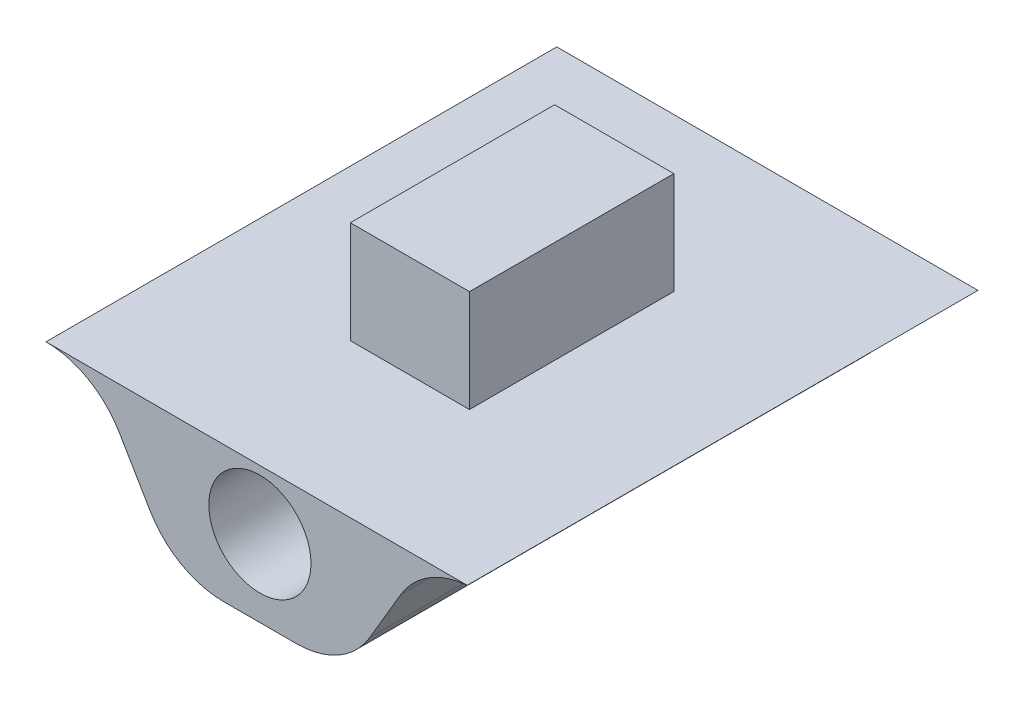
from build123d import *

# Parameters (mm, degrees)
STOCK_AUGET_1_OUTLINE_R = 3
STOCK_AUGET_1_DEPTH     = 30
ESQUISSE1_W             = 7
ESQUISSE1_H             = 12
BOSS_EXTRU_1_DEPTH      = 6


# Read off the part's stored shape, not the designer's step: Stock-auget-1
with BuildPart() as part:
    # Stock-auget-1 outline → Stock-auget-1 (new body)
    with BuildSketch(Plane.XY):
        with BuildLine():
            ThreePointArc((8.256781031, -2.464537089), (9.916165038, -0.760058008), (12.17539903, -0.015298993))
            Line((12.17539903, -0.015298993), (-12.563147232, -9.56e-07))
            ThreePointArc((-12.563147232, -9.56e-07), (-10.082691958, -0.660415437), (-8.256781031, -2.464537089))
            Line((-8.256781031, -2.464537089), (-6.450006579, -5.535462911))
            ThreePointArc((-6.450006579, -5.535462911), (-4.622753843, -7.340352207), (-2.140548629, -8))
            Line((-2.140548629, -8), (2.140548629, -8))
            ThreePointArc((2.140548629, -8), (4.622753843, -7.340352207), (6.450006579, -5.535462911))
            Line((6.450006579, -5.535462911), (8.256781031, -2.464537089))
        make_face()
        with Locations((0, -3.5)):
            Circle(STOCK_AUGET_1_OUTLINE_R, mode=Mode.SUBTRACT)
    extrude(amount=STOCK_AUGET_1_DEPTH)

    # Esquisse1 → Boss.-Extru.1 (add)
    with BuildSketch(Plane(origin=(-4.805e-06, -0.007770331, 0), x_dir=(0.9999998088216733, -0.0006183499145584942, 0), z_dir=(0.0006183499145584943, 0.9999998088216734, 0))):
        with Locations((-0.193144829, -15)):
            Rectangle(ESQUISSE1_W, ESQUISSE1_H)
    extrude(amount=BOSS_EXTRU_1_DEPTH)


solid = part.part
